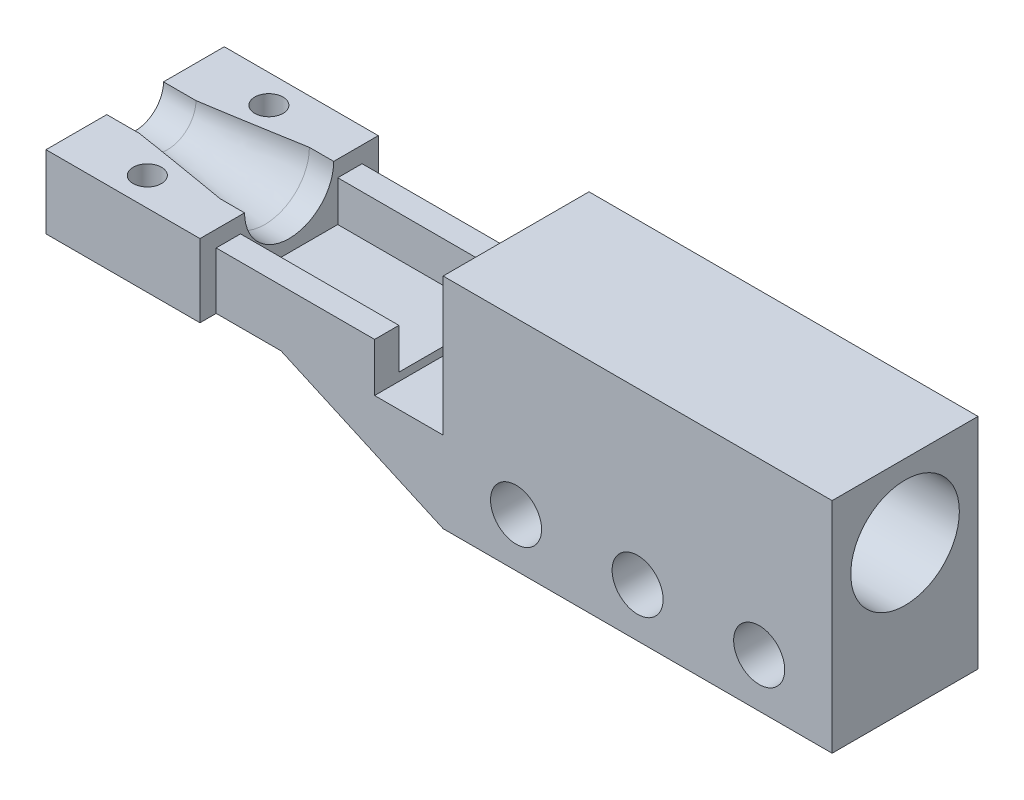
from build123d import *

# Parameters (mm, degrees)
SKETCH_1_W           = 48
SKETCH_1_H           = 18
EXTRUDE_1_DEPTH      = 3.5
SKETCH_6_W           = 18
SKETCH_6_H           = 9
EXTRUDE_4_DEPTH      = 25
SKETCH_7_R           = 3.5
CUT_EXTRUDE_1_DEPTH  = 2
SKETCH_9_R           = 5.5
CUT_EXTRUDE_4_DEPTH  = 3
EXTRUDE_5_OUTLINE_W  = 48
EXTRUDE_5_OUTLINE_H  = 18
EXTRUDE_5_DEPTH      = 20
CUT_EXTRUDE_7_REACH  = 98.344
SKETCH_13_R          = 3
SKETCH_13_R_2        = 1.25
SKETCH_15_R          = 6.7
CUT_EXTRUDE_8_DEPTH  = 45
SKETCH_16_R          = 3.15
CUT_EXTRUDE_9_DEPTH  = 76.081622399
EXTRUDE_6_REACH      = 56.196
SKETCH_17_W          = 18
SKETCH_17_H          = 3
SKETCH_18_W          = 14.545454545
SKETCH_18_H          = 18
EXTRUDE_7_DEPTH      = 2
SKETCH_19_W          = 22.545454545
SKETCH_19_H          = 18
CUT_EXTRUDE_11_DEPTH = 7
SKETCH_20_W          = 19.545454545
SKETCH_20_H          = 3
EXTRUDE_8_DEPTH      = 5
SKETCH_21_W          = 17
SKETCH_21_H          = 9
EXTRUDE_9_DEPTH      = 2
SKETCH_22_R          = 1.75
CUT_EXTRUDE_12_DEPTH = 73.152616166
SKETCH_24_W          = 3
SKETCH_24_H          = 18
CUT_EXTRUDE_13_DEPTH = 1
EXTRUDE_START        = 2
EXTRUDE_10_DEPTH     = 2


with BuildPart() as part:
    # 草圖1 → 填料-伸長1 (new, symmetric)
    with BuildSketch(Plane(origin=(0, 0, 0), x_dir=(1, 0, 0), z_dir=(0, 1, 0))):
        Rectangle(SKETCH_1_W, SKETCH_1_H)
    extrude(amount=EXTRUDE_1_DEPTH, both=True)

    # Sketch 3D_3 → Loft 1 section 0
    with BuildSketch(Plane(origin=(-44, 14.5, -9), x_dir=(0, -0.447213595499958, 0.894427190999916), z_dir=(-1, 0, 0))):
        with BuildLine():
            Line((0, 0), (16.099689438, 8.049844719))
            Line((16.099689438, 8.049844719), (20.124611797, 0))
            Line((20.124611797, 0), (4.024922359, -8.049844719))
            Line((4.024922359, -8.049844719), (0, 0))
        make_face()
    # 草圖5 → Loft 1 section 1
    with BuildSketch(Plane.ZY.offset(24)):
        with BuildLine():
            Line((-9, 3.5), (9, 3.5))
            Line((9, 3.5), (9, -3.5))
            Line((9, -3.5), (-9, -3.5))
            Line((-9, -3.5), (-9, 3.5))
        make_face()
    loft()

    # 草圖6 → 填料-伸長4 (add)
    with BuildSketch(Plane.ZY.offset(44)):
        with Locations((0, 10)):
            Rectangle(SKETCH_6_W, SKETCH_6_H)
    extrude(amount=EXTRUDE_4_DEPTH)

    # 草圖7 → 除料-伸長1 (cut)
    with BuildSketch(Plane.ZY.offset(69)):
        with Locations((0, 14.5)):
            Circle(SKETCH_7_R)
    extrude(amount=-CUT_EXTRUDE_1_DEPTH, mode=Mode.SUBTRACT)

    # Loft 1 2: read off the stored shape, not the designer's step
    # Loft 1 2: loft between two sections, ruled curve by curve
    loft_1_2_from = [
        Edge.make_bspline([(-67, 14.5, 3.5), (-67, 12.75, 3.5), (-67, 11, 2.333333333), (-67, 11, -2.333333333), (-67, 12.75, -3.5), (-67, 14.5, -3.5)], [0, 0, 0, 0, 0.5, 0.5, 1, 1, 1, 1], 3, [1, 0.666666667, 0.5, 0.5, 0.666666667, 1]),
        Edge.make_line((-67, 14.5, -3.5), (-67, 14.5, 3.5)),
    ]
    loft_1_2_to = [
        Edge.make_bspline([(-55, 15.833945938, 5.335783751), (-55, 12.063417219, 6.27841593), (-55, 9, 3.886572043), (-55, 9, -3.886572043), (-55, 12.063417219, -6.27841593), (-55, 15.833945938, -5.335783751)], [0, 0, 0, 0, 0.5, 0.5, 1, 1, 1, 1], 3, [1, 0.552953065, 0.4111804, 0.4111804, 0.552953065, 1]),
        Edge.make_line((-55, 15.833945938, -5.335783751), (-55, 15.833945938, 5.335783751)),
    ]
    loft_1_2 = Solid(Shell([*[Face.make_surface_from_curves(loft_1_2_from[k], loft_1_2_to[k]) for k in range(2)], Face(Wire(loft_1_2_from)), Face(Wire(loft_1_2_to))]))
    add(loft_1_2, mode=Mode.SUBTRACT)

    # 草圖9 → 除料-伸長4 (cut)
    with BuildSketch(Plane.ZY.offset(55)):
        with Locations((3.554e-06, 14.500000002)):
            Circle(SKETCH_9_R)
    extrude(amount=-CUT_EXTRUDE_4_DEPTH, mode=Mode.SUBTRACT)

    # 填料-伸長5: read off the stored shape, not the designer's step
    # 填料-伸長5 outline → 填料-伸長5 (add)
    with BuildSketch(Plane(origin=(0, 3.5, 0), x_dir=(1, 0, 0), z_dir=(0, 1, 0))):
        Rectangle(EXTRUDE_5_OUTLINE_W, EXTRUDE_5_OUTLINE_H)
    extrude(amount=EXTRUDE_5_DEPTH)

    # 草圖13 → 除料-伸長7 (cut, up to next)
    with BuildSketch(Plane.ZY.offset(-24), mode=Mode.PRIVATE) as cut_extrude_7_sk1:
        with Locations(Location((0, 14.5, 0), (0, 0, 180))):
            Circle(SKETCH_13_R)
    cut_extrude_7_tool1 = extrude(cut_extrude_7_sk1.sketch, amount=CUT_EXTRUDE_7_REACH, mode=Mode.PRIVATE) & part.part
    # 草圖13 → 除料-伸長7 (cut, up to next)
    with BuildSketch(Plane.ZY.offset(-24), mode=Mode.PRIVATE) as cut_extrude_7_sk2:
        with Locations(Location((-4.75, 14.5, 0), (0, 0, 180))):
            Circle(SKETCH_13_R_2)
    cut_extrude_7_tool2 = extrude(cut_extrude_7_sk2.sketch, amount=CUT_EXTRUDE_7_REACH, mode=Mode.PRIVATE) & part.part
    # 草圖13 → 除料-伸長7 (cut, up to next)
    with BuildSketch(Plane.ZY.offset(-24), mode=Mode.PRIVATE) as cut_extrude_7_sk3:
        with Locations(Location((4.75, 14.5, 0), (0, 0, 180))):
            Circle(SKETCH_13_R_2)
    cut_extrude_7_tool3 = extrude(cut_extrude_7_sk3.sketch, amount=CUT_EXTRUDE_7_REACH, mode=Mode.PRIVATE) & part.part
    add(cut_extrude_7_tool1.solids().sort_by_distance((24, 14.5, 0))[0], mode=Mode.SUBTRACT)
    add(cut_extrude_7_tool2.solids().sort_by_distance((24, 14.5, -4.75))[0], mode=Mode.SUBTRACT)
    add(cut_extrude_7_tool3.solids().sort_by_distance((24, 14.5, 4.75))[0], mode=Mode.SUBTRACT)

    # 草圖15 → 除料-伸長8 (cut)
    with BuildSketch(Plane(origin=(24, 0, 0), x_dir=(0, 0, -1), z_dir=(1, 0, 0))):
        with Locations((0, 14.5)):
            Circle(SKETCH_15_R)
    extrude(amount=-CUT_EXTRUDE_8_DEPTH, mode=Mode.SUBTRACT)

    # 草圖16 → 除料-伸長9 (cut, through all)
    with BuildSketch(Plane.XY.offset(9)):
        with Locations((15, 2.5)):
            Circle(SKETCH_16_R)
        with Locations((0, 2.5)):
            Circle(SKETCH_16_R)
        with Locations((-15, 2.5)):
            Circle(SKETCH_16_R)
    extrude(amount=-CUT_EXTRUDE_9_DEPTH, mode=Mode.SUBTRACT)

    # 填料-伸長6: up to this face of the body (flat: up to its plane)
    extrude_6_end = Plane(part.part.faces().sort_by_distance((-34, 9, 0))[0])
    # 草圖17 → 填料-伸長6 (add, up to the picked face)
    with BuildSketch(Plane.ZY.offset(24), mode=Mode.PRIVATE) as extrude_6_sk1:
        with Locations((0, 5)):
            Rectangle(SKETCH_17_W, SKETCH_17_H)
    extrude_6_tool1 = split(extrude(extrude_6_sk1.sketch, amount=EXTRUDE_6_REACH, mode=Mode.PRIVATE), bisect_by=extrude_6_end, keep=Keep.BOTH, mode=Mode.PRIVATE)
    add(extrude_6_tool1.solids().sort_by(Axis((-24, 5, 0), (-1, 0, 0)))[0])

    # 草圖18 → 填料-伸長7 (add)
    with BuildSketch(Plane.XZ.offset(-5.5)):
        with Locations((-36.727272728, 0)):
            Rectangle(SKETCH_18_W, SKETCH_18_H)
    extrude(amount=-EXTRUDE_7_DEPTH)

    # 草圖19 → 除料-伸長11 (cut)
    with BuildSketch(Plane(origin=(0, 7.5, 0), x_dir=(1, 0, 0), z_dir=(0, 1, 0))):
        with Locations((-40.727272728, 0)):
            Rectangle(SKETCH_19_W, SKETCH_19_H)
    extrude(amount=CUT_EXTRUDE_11_DEPTH, mode=Mode.SUBTRACT)

    # 草圖20 → 填料-伸長8 (add)
    with BuildSketch(Plane(origin=(0, 7.5, 0), x_dir=(1, 0, 0), z_dir=(0, 1, 0))):
        with Locations((-42.227272728, -7.5)):
            Rectangle(SKETCH_20_W, SKETCH_20_H)
    extrude_8 = extrude(amount=EXTRUDE_8_DEPTH)

    # 鏡射1: 填料-伸長8 across plane
    add(extrude_8.mirror(Plane.XY))

    # 草圖21 → 填料-伸長9 (add)
    with BuildSketch(Plane.XY.offset(9)):
        with Locations((-60.5, 10)):
            Rectangle(SKETCH_21_W, SKETCH_21_H)
    extrude_9 = extrude(amount=EXTRUDE_9_DEPTH)

    # 鏡射2: 填料-伸長9 across plane
    add(extrude_9.mirror(Plane.XY))

    # 草圖22 → 除料-伸長12 (cut, through all)
    with BuildSketch(Plane(origin=(0, 14.5, 0), x_dir=(1, 0, 0), z_dir=(0, 1, 0))):
        with Locations(Location((-62, -7.5, 0), (0, 0, 270))):
            Circle(SKETCH_22_R)
        with Locations(Location((-62, 7.5, 0), (0, 0, 270))):
            Circle(SKETCH_22_R)
    extrude(amount=-CUT_EXTRUDE_12_DEPTH, mode=Mode.SUBTRACT)

    # 草圖24 → 除料-伸長13 (cut)
    with BuildSketch(Plane(origin=(0, 7.5, 0), x_dir=(1, 0, 0), z_dir=(0, 1, 0))):
        with Locations((-30.954545455, 0)):
            Rectangle(SKETCH_24_W, SKETCH_24_H)
    extrude(amount=-CUT_EXTRUDE_13_DEPTH, mode=Mode.SUBTRACT)

    # 草圖25 → 填料-伸長10 (add)
    with BuildSketch(Plane.ZY.offset(69).offset(EXTRUDE_START)):
        with BuildLine():
            Line((3.5, 14.5), (11, 14.5))
            Line((11, 14.5), (11, 5.5))
            Line((11, 5.5), (-11, 5.5))
            Line((-11, 5.5), (-11, 14.5))
            Line((-11, 14.5), (-3.5, 14.5))
            ThreePointArc((-3.5, 14.5), (0, 11), (3.5, 14.5))
        make_face()
    extrude(amount=-EXTRUDE_10_DEPTH)


solid = part.part
